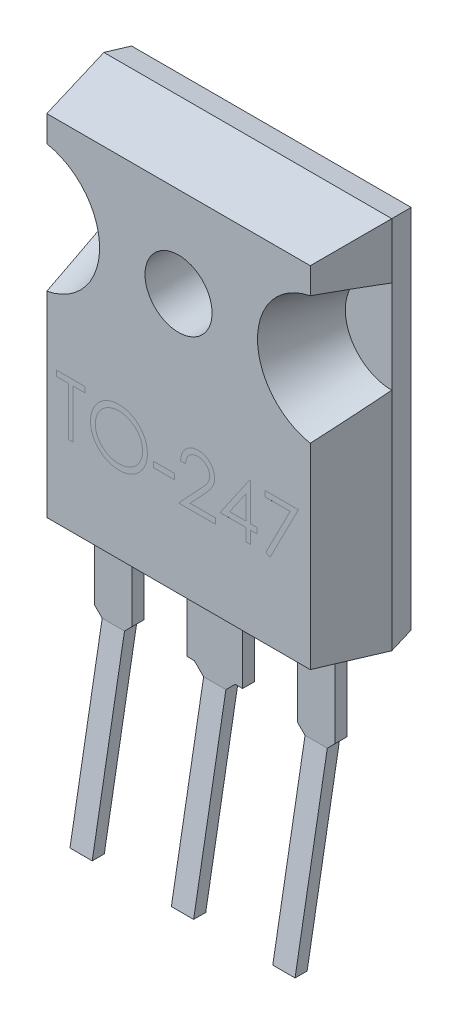
from build123d import *

# Parameters (mm, degrees)
SKETCH1_W                     = 15.5
SKETCH1_H                     = 20.15
BOSS_EXTRUDE1_DEPTH           = 1.27
BOSS_EXTRUDE1_TAPER           = 10
BOSS_EXTRUDE1_OTHER_WAY_DEPTH = 3.73
BOSS_EXTRUDE1_OTHER_WAY_TAPER = 10
SKETCH2_R                     = 2.5
CUT_EXTRUDE1_DEPTH            = 3.73
CUT_EXTRUDE1_DRAFT            = -15
CUT_EXTRUDE1_PROFILE_2_DEPTH  = 3.73
CUT_EXTRUDE1_PROFILE_2_DRAFT  = -15
CUT_EXTRUDE2_DEPTH            = 14.246925249
CUT_EXTRUDE2_DEPTH_BACK       = 14.246925249
SKETCH4_R                     = 1.805
SKETCH5_W                     = 2.02
SKETCH5_H                     = 0.65
SKETCH5_W_2                   = 3
BOSS_EXTRUDE2_DEPTH           = 14.07
SKETCH6_W                     = 7.97
SKETCH6_H                     = 2.154431013
BOSS_EXTRUDE3_DEPTH           = 0.65
SKETCH7_R                     = 1.805
BOSS_EXTRUDE4_DEPTH           = 0.0001
BOSS_EXTRUDE5_DEPTH           = 0.65
CUT_EXTRUDE3_DEPTH            = 1
CHAMFER1_SIZE                 = 0.5
SKETCH10_W                    = 1.119391026
SKETCH10_H                    = 0.298504273
CUT_EXTRUDE4_DEPTH            = 0.0001
CUT_EXTRUDE5_DEPTH            = 27.651004246
CUT_EXTRUDE5_DEPTH_BACK       = 27.651004246
SKETCH11_W                    = 12.12
SKETCH11_H                    = 10.655
SKETCH13_W                    = 1.2
SKETCH13_H                    = 0.65
BOSS_EXTRUDE7_DEPTH           = 10


with BuildPart() as part:
    # Sketch1 → Boss-Extrude1 (new body)
    with BuildSketch(Plane.XY):
        Rectangle(SKETCH1_W, SKETCH1_H)
    extrude(amount=-BOSS_EXTRUDE1_DEPTH, taper=BOSS_EXTRUDE1_TAPER)

    # Sketch1 → Boss-Extrude1 other way (add)
    with BuildSketch(Plane.XY):
        Rectangle(SKETCH1_W, SKETCH1_H)
    extrude(amount=BOSS_EXTRUDE1_OTHER_WAY_DEPTH, taper=BOSS_EXTRUDE1_OTHER_WAY_TAPER)


with BuildPart() as cut_extrude1_tool:
    # Sketch2 → Cut-Extrude1 (with draft: the straight prism first)
    with BuildSketch(Plane.XY):
        with Locations((-7.75, 4.575)):
            Circle(SKETCH2_R)
    extrude(amount=CUT_EXTRUDE1_DEPTH)
    # Cut-Extrude1: the draft: its side faces are tilted about the plane it starts from
    cut_extrude1_sides = [cut_extrude1_tool.faces().sort_by_distance(p)[0] for p in [
        (-10.25, 4.575, 1.865),
    ]]
    draft(cut_extrude1_sides, Plane.XY, CUT_EXTRUDE1_DRAFT)


with BuildPart() as part_1:
    add(part.part)

    # Cut-Extrude1: cut by cut_extrude1_tool
    add(cut_extrude1_tool.part, mode=Mode.SUBTRACT)


with BuildPart() as cut_extrude1_profile_2_tool:
    # Sketch2 → Cut-Extrude1 profile 2 (with draft: the straight prism first)
    with BuildSketch(Plane.XY):
        with Locations((7.75, 4.575)):
            Circle(SKETCH2_R)
    extrude(amount=CUT_EXTRUDE1_PROFILE_2_DEPTH)
    # Cut-Extrude1 profile 2: the draft: its side faces are tilted about the plane it starts from
    cut_extrude1_profile_2_sides = [cut_extrude1_profile_2_tool.faces().sort_by_distance(p)[0] for p in [
        (5.25, 4.575, 1.865),
    ]]
    draft(cut_extrude1_profile_2_sides, Plane.XY, CUT_EXTRUDE1_PROFILE_2_DRAFT)


with BuildPart() as part_2:
    add(part_1.part)

    # Cut-Extrude1 profile 2: cut by cut_extrude1_profile_2_tool
    add(cut_extrude1_profile_2_tool.part, mode=Mode.SUBTRACT)

    # Sketch4 → Cut-Extrude2 (cut, two sides: drawn at the far end of the back side and taken through both)
    with BuildSketch(Plane.XY.offset(-CUT_EXTRUDE2_DEPTH_BACK)):
        with Locations(Location((0, 4.565, 0), (0, 0, 180))):
            Circle(SKETCH4_R)
    extrude(amount=CUT_EXTRUDE2_DEPTH + CUT_EXTRUDE2_DEPTH_BACK, mode=Mode.SUBTRACT)

    # Sketch5 → Boss-Extrude2 (add)
    with BuildSketch(Plane(origin=(0, 0, 0), x_dir=(1, 0, 0), z_dir=(0, 1, 0))):
        with Locations((-5.46, -1.455)):
            Rectangle(SKETCH5_W, SKETCH5_H)
        with Locations((5.46, -1.455)):
            Rectangle(SKETCH5_W, SKETCH5_H)
        with Locations((0, -1.455)):
            Rectangle(SKETCH5_W_2, SKETCH5_H)
    extrude(amount=-BOSS_EXTRUDE2_DEPTH)

    # Sketch6 → Boss-Extrude3 (add)
    with BuildSketch(Plane.XY.offset(1.78)):
        with Locations((-2.485, -12.992784494)):
            Rectangle(SKETCH6_W, SKETCH6_H)
    extrude(amount=-BOSS_EXTRUDE3_DEPTH)

    # Sketch7 → Boss-Extrude4 (add)
    with BuildSketch(Plane(origin=(0, 0, -1.27), x_dir=(-1, 0, 0), z_dir=(0, 0, -1))):
        with BuildLine():
            Line((-5.9, 9.225), (5.9, 9.225))
            ThreePointArc((5.9, 9.225), (6.607106781, 8.932106781), (6.9, 8.225))
            Line((6.9, 8.225), (6.9, -3.855))
            Line((6.9, -3.855), (-6.9, -3.855))
            Line((-6.9, -3.855), (-6.9, 8.225))
            ThreePointArc((-6.9, 8.225), (-6.607106781, 8.932106781), (-5.9, 9.225))
        make_face()
        with Locations((0, 4.565)):
            Circle(SKETCH7_R, mode=Mode.SUBTRACT)
    extrude(amount=BOSS_EXTRUDE4_DEPTH)

    # Sketch8 → Boss-Extrude5 (add)
    with BuildSketch(Plane.XY.offset(1.78)):
        Polygon((-6.06, -14.07), (-6.06, -24.185769515), (-5.46, -25.225), (-4.86, -24.185769515), (-4.86, -14.07), align=None)
        Polygon((6.06, -14.07), (6.06, -24.185769515), (5.46, -25.225), (4.86, -24.185769515), (4.86, -14.07), align=None)
        Polygon((-0.6, -14.07), (-0.6, -24.185769515), (0, -25.225), (0.6, -24.185769515), (0.6, -14.07), align=None)
    extrude(amount=-BOSS_EXTRUDE5_DEPTH)

    # Sketch9 → Cut-Extrude3 (cut)
    with BuildSketch(Plane.XY.offset(1.78)):
        Polygon((-1.5, -11.915568987), (-1.5, -14.07), (-1.5, -14.32), (-4.45, -14.32), (-4.45, -14.07), (-4.45, -11.915568987), align=None)
    extrude(amount=-CUT_EXTRUDE3_DEPTH, mode=Mode.SUBTRACT)

    # Chamfer1
    # the kernel refuses this chamfer: 0.5 mm, written as the material it adds along each edge
    with BuildSketch(Plane(origin=(-4.86, -14.07, 1.78), x_dir=(0.9996219169112968, 0.027495876610585647, 0), z_dir=(0, 0, -1))) as chamfer1_piece_1_section:
        Polygon((CHAMFER1_SIZE * 0.999621916911, CHAMFER1_SIZE * 0.0274958766106), (-CHAMFER1_SIZE * 0.0274958766106, CHAMFER1_SIZE * 0.999621916911), (0, 0), align=None)
    chamfer1_piece_1 = extrude(amount=0.65, mode=Mode.PRIVATE)
    chamfer1_piece_1 = split(chamfer1_piece_1, bisect_by=Plane(origin=(-4.45, -14.241727984, 1.455), z_dir=(-1, 0, 0)), keep=Keep.TOP, mode=Mode.PRIVATE)
    add(chamfer1_piece_1)
    with BuildSketch(Plane(origin=(-6.06, -14.07, 1.78), x_dir=(-0.9996219169112968, 0.027495876610585647, 0), z_dir=(0, 0, -1))) as chamfer1_piece_2_section:
        Polygon((CHAMFER1_SIZE * 0.999621916911, -CHAMFER1_SIZE * 0.0274958766106), (-CHAMFER1_SIZE * 0.0274958766106, -CHAMFER1_SIZE * 0.999621916911), (0, 0), align=None)
    chamfer1_piece_2 = extrude(amount=0.65, mode=Mode.PRIVATE)
    chamfer1_piece_2 = split(chamfer1_piece_2, bisect_by=Plane(origin=(-6.47, -14.241727984, 1.455), z_dir=(1, 0, 0)), keep=Keep.TOP, mode=Mode.PRIVATE)
    add(chamfer1_piece_2)
    with BuildSketch(Plane(origin=(0.6, -14.07, 1.78), x_dir=(0.9996219169112968, 0.027495876610585647, 0), z_dir=(0, 0, -1))) as chamfer1_piece_3:
        Polygon((CHAMFER1_SIZE * 0.999621916911, CHAMFER1_SIZE * 0.0274958766106), (-CHAMFER1_SIZE * 0.0274958766106, CHAMFER1_SIZE * 0.999621916911), (0, 0), align=None)
    extrude(amount=0.65)
    with BuildSketch(Plane(origin=(-0.6, -14.07, 1.78), x_dir=(-0.9996219169112968, 0.027495876610585616, 0), z_dir=(0, 0, -1))) as chamfer1_piece_4:
        Polygon((CHAMFER1_SIZE * 0.999621916911, -CHAMFER1_SIZE * 0.0274958766106), (-CHAMFER1_SIZE * 0.0274958766106, -CHAMFER1_SIZE * 0.999621916911), (0, 0), align=None)
    extrude(amount=0.65)
    with BuildSketch(Plane(origin=(6.06, -14.07, 1.78), x_dir=(0.999621916911297, 0.0274958766105822, 0), z_dir=(0, 0, -1))) as chamfer1_piece_5_section:
        Polygon((CHAMFER1_SIZE * 0.999621916911, CHAMFER1_SIZE * 0.0274958766106), (-CHAMFER1_SIZE * 0.0274958766106, CHAMFER1_SIZE * 0.999621916911), (0, 0), align=None)
    chamfer1_piece_5 = extrude(amount=0.65, mode=Mode.PRIVATE)
    chamfer1_piece_5 = split(chamfer1_piece_5, bisect_by=Plane(origin=(6.47, -14.241727984, 1.455), z_dir=(-1, 0, 0)), keep=Keep.TOP, mode=Mode.PRIVATE)
    add(chamfer1_piece_5)
    with BuildSketch(Plane(origin=(4.86, -14.07, 1.78), x_dir=(-0.999621916911297, 0.0274958766105822, 0), z_dir=(0, 0, -1))) as chamfer1_piece_6_section:
        Polygon((CHAMFER1_SIZE * 0.999621916911, -CHAMFER1_SIZE * 0.0274958766106), (-CHAMFER1_SIZE * 0.0274958766106, -CHAMFER1_SIZE * 0.999621916911), (0, 0), align=None)
    chamfer1_piece_6 = extrude(amount=0.65, mode=Mode.PRIVATE)
    chamfer1_piece_6 = split(chamfer1_piece_6, bisect_by=Plane(origin=(4.45, -14.241727984, 1.455), z_dir=(1, 0, 0)), keep=Keep.TOP, mode=Mode.PRIVATE)
    add(chamfer1_piece_6)

    # Sketch10 → Cut-Extrude4 (cut)
    # profile 1 of 6: a face of its own
    with BuildSketch(Plane.XY.offset(3.73)):
        Polygon((-6.567094017, -2.579909172), (-6.567094017, -2.281404898), (-5.037259615, -2.281404898), (-5.037259615, -2.579909172), (-5.671581197, -2.579909172), (-5.671581197, -5.191821565), (-5.932772436, -5.191821565), (-5.932772436, -2.579909172), align=None)
    # profile 2 of 6: a face of its own
    with BuildSketch(Plane.XY.offset(3.73)):
        with BuildLine():
            add(Edge.make_bspline(
                [(-3.227577457, -2.20677883), (-3.173686431, -2.208143798), (-3.067840009, -2.210824709), (-2.912278324, -2.231346558), (-2.763767997, -2.266849808), (-2.621099257, -2.314134086), (-2.485978609, -2.377210619), (-2.357389006, -2.453451186), (-2.235636404, -2.543654527), (-2.122361838, -2.647123355), (-2.018703648, -2.759701143), (-1.927378194, -2.879841405), (-1.850840643, -3.006817731), (-1.787987462, -3.140248553), (-1.738677844, -3.279832109), (-1.704651711, -3.426312551), (-1.682916594, -3.578740793), (-1.68037557, -3.682706584), (-1.679086538, -3.735447199)],
                knots=[0, 0, 0, 0, 1.065120563, 2.091984664, 3.0946048, 4.079830382, 5.057816894, 6.036188127, 7.030412546, 8.04752943, 9.064399622, 10.05169764, 11.02544977, 11.989514704, 12.962713494, 13.945757189, 14.957906945, 16, 16, 16, 16], degree=3))
            add(Edge.make_bspline(
                [(-1.679086538, -3.735447199), (-1.680375381, -3.787799314), (-1.682915839, -3.890991397), (-1.704676424, -4.042452344), (-1.73880397, -4.188048596), (-1.787529556, -4.327537094), (-1.850083123, -4.461064985), (-1.92713031, -4.588280922), (-2.017886424, -4.709226612), (-2.121170335, -4.822577084), (-2.233762749, -4.926518433), (-2.354528632, -5.017089665), (-2.480752006, -5.095025737), (-2.614057162, -5.157211923), (-2.75267618, -5.206915122), (-2.897849696, -5.240802874), (-3.048897455, -5.262661802), (-3.151902093, -5.265171842), (-3.204256811, -5.266447633)],
                knots=[0, 0, 0, 0, 1.043624062, 2.057103931, 3.04512605, 4.022047818, 4.998200453, 5.980619268, 6.982898556, 8.009068085, 9.034988726, 10.034168286, 11.015286542, 11.987931943, 12.962482838, 13.94673481, 14.956375938, 16, 16, 16, 16], degree=3))
            add(Edge.make_bspline(
                [(-3.204256811, -5.266447633), (-3.256997152, -5.265159244), (-3.360962405, -5.262619487), (-3.513582189, -5.240848402), (-3.660165527, -5.206803758), (-3.800293235, -5.158150376), (-3.934043453, -5.095271048), (-4.061677766, -5.018598716), (-4.182683866, -4.927621468), (-4.296058521, -4.824371049), (-4.39979342, -4.711969466), (-4.49023202, -4.591532887), (-4.566921593, -4.465424153), (-4.629589793, -4.333293295), (-4.679203632, -4.195779065), (-4.713051627, -4.051964171), (-4.734951225, -3.902668522), (-4.737474844, -3.801017731), (-4.738755342, -3.749439587)],
                knots=[0, 0, 0, 0, 1.053102029, 2.075944431, 3.073151272, 4.055350789, 5.033113405, 6.020478099, 7.024410459, 8.052272461, 9.079885166, 10.07527673, 11.055994387, 12.023226415, 12.992069828, 13.970394897, 14.97016774, 16, 16, 16, 16], degree=3))
            add(Edge.make_bspline(
                [(-4.738755342, -3.749439587), (-4.738310767, -3.71482004), (-4.737427226, -3.646017688), (-4.726790324, -3.543848259), (-4.711355386, -3.44332192), (-4.689234629, -3.344724531), (-4.660303701, -3.24829745), (-4.626166985, -3.153375655), (-4.584473316, -3.060921094), (-4.537340658, -2.970495786), (-4.484735453, -2.883509331), (-4.426630439, -2.801286249), (-4.365066505, -2.723136575), (-4.297575278, -2.651085465), (-4.226381127, -2.583036883), (-4.150329131, -2.520036576), (-4.069883348, -2.461516453), (-3.984697631, -2.408779419), (-3.896871006, -2.361082567), (-3.80633478, -2.320152254), (-3.714318572, -2.285022643), (-3.620391403, -2.256549766), (-3.524802699, -2.234071341), (-3.427343834, -2.21876475), (-3.328092451, -2.208100719), (-3.26122661, -2.207221355), (-3.227577457, -2.20677883)],
                knots=[0, 0, 0, 0, 1.037015668, 2.060948919, 3.074880161, 4.083647147, 5.086022904, 6.090072063, 7.104153813, 8.122640571, 9.144368836, 10.147691507, 11.138137339, 12.123020368, 13.103399296, 14.087645067, 15.080126199, 16.082011238, 17.087798457, 18.072939717, 19.057185487, 20.037253025, 21.01195951, 21.997135196, 22.992090687, 24, 24, 24, 24], degree=3))
        make_face()
        with BuildLine():
            add(Edge.make_bspline(
                [(-3.214751102, -2.505283103), (-3.242370651, -2.505619789), (-3.297345705, -2.506289941), (-3.379073977, -2.515117414), (-3.459727389, -2.527698637), (-3.539322597, -2.5456447), (-3.617526565, -2.57009557), (-3.695068248, -2.598235896), (-3.77124055, -2.632513196), (-3.845792002, -2.671240618), (-3.918066025, -2.714106), (-3.986263492, -2.761480737), (-4.050560952, -2.812253833), (-4.110800978, -2.866543778), (-4.166806685, -2.924627048), (-4.219680392, -2.985623092), (-4.267302777, -3.051275349), (-4.310947033, -3.119803527), (-4.350003029, -3.191118365), (-4.38473291, -3.264469066), (-4.41314191, -3.340453964), (-4.436310803, -3.418248701), (-4.455519396, -3.497730068), (-4.4676882, -3.579501009), (-4.476612668, -3.663150635), (-4.477244516, -3.719680784), (-4.477564103, -3.748273555)],
                knots=[0, 0, 0, 0, 1.008559885, 2.007477868, 2.99961109, 3.989939068, 4.984837346, 5.991145699, 7.001802488, 8.033829008, 9.059044045, 10.069351652, 11.065060232, 12.050310815, 13.029377138, 14.011219647, 14.996725999, 15.989392538, 16.977580475, 17.965360261, 18.951710183, 19.937753436, 20.929683414, 21.935841486, 22.955955122, 24, 24, 24, 24], degree=3))
            add(Edge.make_bspline(
                [(-4.477564103, -3.748273555), (-4.476503994, -3.790318449), (-4.474418433, -3.873033763), (-4.456159668, -3.994246916), (-4.428035085, -4.110736997), (-4.386576311, -4.221866609), (-4.334728806, -4.328590992), (-4.270677279, -4.429963386), (-4.194791003, -4.526011189), (-4.108589845, -4.616063862), (-4.014356618, -4.698258855), (-3.914294223, -4.770406761), (-3.809474646, -4.83145088), (-3.699624542, -4.881181645), (-3.585330368, -4.920588469), (-3.465855643, -4.947595997), (-3.341996243, -4.965370706), (-3.257568668, -4.96707767), (-3.214751102, -4.96794336)],
                knots=[0, 0, 0, 0, 1.032063989, 2.030389145, 3.003944642, 3.970395727, 4.937377036, 5.913328081, 6.909231446, 7.93887556, 8.970685674, 9.976071282, 10.964166581, 11.944589148, 12.933237628, 13.927779006, 14.949070134, 16, 16, 16, 16], degree=3))
            add(Edge.make_bspline(
                [(-3.214751102, -4.96794336), (-3.185971653, -4.967547955), (-3.128893363, -4.966763749), (-3.043996074, -4.958865147), (-2.96062826, -4.946199123), (-2.878906854, -4.927962738), (-2.798924603, -4.905139079), (-2.720347674, -4.8780242), (-2.644013024, -4.844195842), (-2.568957671, -4.80681948), (-2.497115082, -4.764210849), (-2.42853275, -4.718444007), (-2.364939331, -4.667745696), (-2.304744371, -4.614262372), (-2.248508727, -4.556915648), (-2.196612685, -4.495780083), (-2.149230991, -4.430469786), (-2.105603308, -4.362045553), (-2.066684166, -4.290535574), (-2.032774403, -4.216918931), (-2.004006086, -4.141376897), (-1.980782204, -4.063800512), (-1.9625834, -3.984337116), (-1.950043729, -3.902880309), (-1.9412722, -3.819593047), (-1.940611055, -3.763260805), (-1.940277778, -3.734864183)],
                knots=[0, 0, 0, 0, 1.047197238, 2.076906641, 3.100256066, 4.114471768, 5.12198147, 6.126382909, 7.136867548, 8.15857795, 9.17633901, 10.174870724, 11.156907918, 12.133735059, 13.104061851, 14.077631395, 15.04955518, 16.038496417, 17.029181396, 18.010275684, 18.986308667, 19.968651475, 20.955262928, 21.950658345, 22.966943676, 24, 24, 24, 24], degree=3))
            add(Edge.make_bspline(
                [(-1.940277778, -3.734864183), (-1.940611322, -3.706661826), (-1.941272969, -3.650717257), (-1.950039539, -3.56801085), (-1.962596648, -3.487140173), (-1.980693377, -3.408422713), (-2.004018415, -3.331838404), (-2.032779427, -3.257459174), (-2.066694346, -3.185007931), (-2.105617614, -3.114663745), (-2.149370176, -3.047163085), (-2.197179377, -2.982632983), (-2.249870682, -2.922285293), (-2.305938632, -2.864630193), (-2.366783708, -2.810897341), (-2.43213029, -2.761068912), (-2.501185063, -2.713942385), (-2.574300746, -2.671429046), (-2.649758665, -2.632168163), (-2.727187355, -2.598531228), (-2.805709648, -2.569949174), (-2.885125865, -2.545570721), (-2.966104449, -2.527768925), (-3.048098228, -2.515106076), (-3.130993762, -2.506293014), (-3.186743392, -2.505620809), (-3.214751102, -2.505283103)],
                knots=[0, 0, 0, 0, 1.02996197, 2.043119294, 3.035359645, 4.018872909, 4.991431989, 5.957985074, 6.929999688, 7.912076566, 8.892894881, 9.867085534, 10.843653904, 11.817741046, 12.803660682, 13.806313499, 14.818574707, 15.856120519, 16.894564902, 17.924820532, 18.937903209, 19.946497019, 20.957711757, 21.963978472, 22.977135795, 24, 24, 24, 24], degree=3))
        make_face(mode=Mode.SUBTRACT)
    # profile 3 of 6: a face of its own
    with BuildSketch(Plane.XY.offset(3.73)):
        with Locations((-0.783573718, -4.07243054)):
            Rectangle(SKETCH10_W, SKETCH10_H)
    # profile 4 of 6: a face of its own
    with BuildSketch(Plane.XY.offset(3.73)):
        with BuildLine():
            Line((0.373130342, -3.176917719), (0.111939103, -3.176917719))
            add(Edge.make_bspline(
                [(0.111939103, -3.176917719), (0.113641408, -3.142266391), (0.11698469, -3.074212106), (0.132641309, -2.974988596), (0.155043931, -2.8801466), (0.186718789, -2.79044763), (0.226056212, -2.705098574), (0.273229931, -2.624438442), (0.329104817, -2.548774935), (0.392474346, -2.478809481), (0.46130041, -2.41462434), (0.535562552, -2.359197331), (0.613599161, -2.312366506), (0.695173482, -2.273216211), (0.781205868, -2.243829447), (0.870915601, -2.222024905), (0.964696824, -2.208906122), (1.028592961, -2.207495995), (1.06108941, -2.20677883)],
                knots=[0, 0, 0, 0, 1.10065271, 2.161652631, 3.183658789, 4.190468796, 5.17591951, 6.163126047, 7.15150782, 8.156236427, 9.156009102, 10.134482811, 11.092018607, 12.041330605, 13.001268258, 13.972401359, 14.968799086, 16, 16, 16, 16], degree=3))
            add(Edge.make_bspline(
                [(1.06108941, -2.20677883), (1.093002606, -2.207525939), (1.155710896, -2.208993982), (1.247232702, -2.2216011), (1.334360012, -2.24134669), (1.416922518, -2.269050046), (1.494261489, -2.306290429), (1.566957914, -2.351025645), (1.635877255, -2.402764397), (1.697916348, -2.463678431), (1.754884078, -2.528707438), (1.804030418, -2.598131606), (1.846117673, -2.669835363), (1.881198738, -2.74436548), (1.907023397, -2.822423711), (1.926629799, -2.902873617), (1.937712178, -2.986547939), (1.939413046, -3.043181783), (1.940277778, -3.07197481)],
                knots=[0, 0, 0, 0, 1.111607364, 2.184268762, 3.212621178, 4.221274766, 5.211760367, 6.196651075, 7.1921475, 8.207485113, 9.220403448, 10.201281604, 11.166441695, 12.114753415, 13.065576456, 14.026450734, 14.996634279, 16, 16, 16, 16], degree=3))
            add(Edge.make_bspline(
                [(1.940277778, -3.07197481), (1.938869749, -3.112510956), (1.936078401, -3.192871896), (1.912201029, -3.310964017), (1.87490902, -3.425379497), (1.830007646, -3.517462836), (1.784711215, -3.591664736), (1.743892615, -3.652757462), (1.696107888, -3.718537426), (1.640661542, -3.788784355), (1.57870054, -3.864048483), (1.509663658, -3.944284342), (1.433058596, -4.028662951), (1.379291974, -4.086293859), (1.351431457, -4.116156751)],
                knots=[0, 0, 0, 0, 1.184426356, 2.348067706, 3.509069118, 4.696110526, 5.333549288, 6.050745305, 6.844228056, 7.710549037, 8.667450064, 9.695053472, 10.805634456, 12, 12, 12, 12], degree=3))
            Line((1.351431457, -4.116156751), (0.623244274, -4.893317292))
            Line((0.623244274, -4.893317292), (1.977590812, -4.893317292))
            Line((1.977590812, -4.893317292), (1.977590812, -5.191821565))
            Line((1.977590812, -5.191821565), (0, -5.191821565))
            Line((0, -5.191821565), (1.128719284, -3.98731018))
            add(Edge.make_bspline(
                [(1.128719284, -3.98731018), (1.156200176, -3.958623195), (1.208985344, -3.903521369), (1.283643832, -3.823074991), (1.350698991, -3.748443974), (1.410584883, -3.679769326), (1.462002387, -3.616046528), (1.507631261, -3.559339385), (1.544190743, -3.507156071), (1.583868367, -3.446668787), (1.622297493, -3.372817116), (1.655320208, -3.282566185), (1.675456008, -3.189659654), (1.677871517, -3.126876115), (1.679086538, -3.095295457)],
                knots=[0, 0, 0, 0, 1.329631726, 2.553950428, 3.673215718, 4.687767853, 5.603093632, 6.413772471, 7.123043292, 7.734684054, 8.834405432, 9.900288307, 10.943827018, 12, 12, 12, 12], degree=3))
            add(Edge.make_bspline(
                [(1.679086538, -3.095295457), (1.678557888, -3.075436937), (1.677516021, -3.036299607), (1.668321019, -2.978918032), (1.654425437, -2.92356622), (1.634513815, -2.87007391), (1.608231305, -2.818978924), (1.576238858, -2.770219067), (1.539326406, -2.723079493), (1.496625381, -2.678879995), (1.449716516, -2.638399254), (1.400161059, -2.602539524), (1.347731895, -2.572571287), (1.292650079, -2.548004462), (1.235069174, -2.528733029), (1.174877812, -2.515379556), (1.112242305, -2.50699549), (1.069472904, -2.505861116), (1.047680038, -2.505283103)],
                knots=[0, 0, 0, 0, 0.991446411, 1.95395049, 2.89581595, 3.838931463, 4.798493298, 5.75982156, 6.748411868, 7.785213223, 8.824556874, 9.840280684, 10.836137867, 11.835679398, 12.848801643, 13.863922112, 14.911575587, 16, 16, 16, 16], degree=3))
            add(Edge.make_bspline(
                [(1.047680038, -2.505283103), (1.024919887, -2.505877687), (0.980222709, -2.50704535), (0.914597775, -2.515213363), (0.851994066, -2.529304637), (0.792254103, -2.548577145), (0.735276804, -2.573073331), (0.681339263, -2.603584264), (0.630562563, -2.639992323), (0.582851251, -2.68127081), (0.538892335, -2.727228452), (0.500269546, -2.77846007), (0.466522006, -2.834030248), (0.437077542, -2.893789044), (0.413165817, -2.958278705), (0.394894096, -3.027270303), (0.380436105, -3.100464273), (0.375606043, -3.151009966), (0.373130342, -3.176917719)],
                knots=[0, 0, 0, 0, 1.031018746, 2.02475058, 2.990194455, 3.934040569, 4.864654155, 5.795059489, 6.735614925, 7.690564532, 8.649604399, 9.611025574, 10.590972636, 11.591080095, 12.624614302, 13.701020113, 14.821632451, 16, 16, 16, 16], degree=3))
        make_face()
    # profile 5 of 6: a face of its own
    with BuildSketch(Plane.XY.offset(3.73)):
        Polygon((3.827501085, -2.20677883), (3.880555556, -2.20677883), (3.880555556, -4.221682676), (4.216372863, -4.221682676), (4.216372863, -4.52018695), (3.880555556, -4.52018695), (3.880555556, -5.191821565), (3.619364316, -5.191821565), (3.619364316, -4.52018695), (2.238782051, -4.52018695), align=None)
        Polygon((3.619364316, -4.221682676), (3.619364316, -2.957703643), (2.751836271, -4.221682676), align=None, mode=Mode.SUBTRACT)
    # profile 6 of 6: a face of its own
    with BuildSketch(Plane.XY.offset(3.73)):
        Polygon((4.664129274, -2.281404898), (6.455154915, -2.281404898), (4.925320513, -5.266447633), (4.699693259, -5.142265191), (6.013228666, -2.579909172), (4.664129274, -2.579909172), align=None)
    extrude(amount=-CUT_EXTRUDE4_DEPTH, mode=Mode.SUBTRACT)

    # Sketch11 → Cut-Extrude5 (cut, two sides: drawn at the far end of the back side and taken through both)
    with BuildSketch(Plane.XY.offset(-CUT_EXTRUDE5_DEPTH_BACK)):
        with Locations((0, -19.8975)):
            Rectangle(SKETCH11_W, SKETCH11_H)
    extrude(amount=CUT_EXTRUDE5_DEPTH + CUT_EXTRUDE5_DEPTH_BACK, mode=Mode.SUBTRACT)

    # Sketch13 → Boss-Extrude7 (add, along a direction that is not the sketch's normal)
    with BuildSketch(Plane.XZ.offset(14.57)):
        with Locations((5.46, 1.455)):
            Rectangle(SKETCH13_W, SKETCH13_H)
        with Locations((-5.46, 1.455)):
            Rectangle(SKETCH13_W, SKETCH13_H)
        with Locations((0, 1.455)):
            Rectangle(SKETCH13_W, SKETCH13_H)
    extrude(amount=BOSS_EXTRUDE7_DEPTH, dir=(0, -0.984807753012208, 0.17364817766693055))


solid = part_2.part
